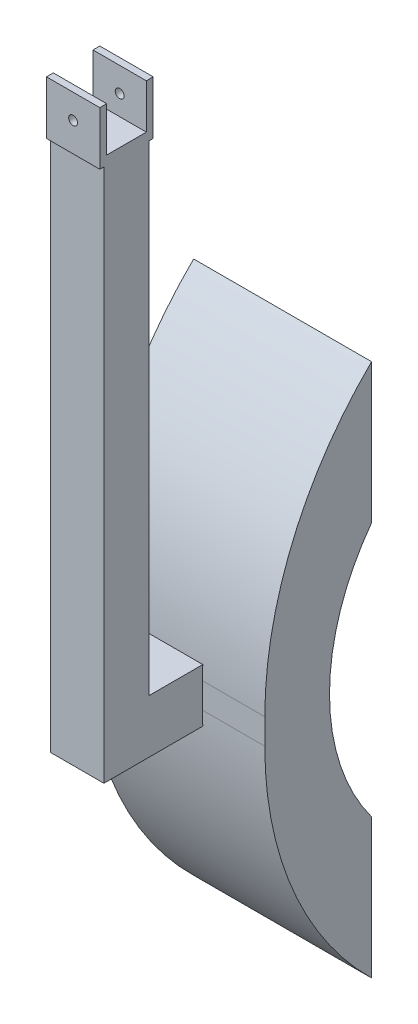
from build123d import *

# Parameters (mm, degrees)
SKETCH_1_W               = 30
SKETCH_1_H               = 22.307
EXTRUDE_1_DEPTH          = 2.5
EXTRUDE_START            = -5
SKETCH_4_W               = 30
SKETCH_4_H               = 3.8465
EXTRUDE_5_DEPTH          = 30
SKETCH_5_R               = 2.5
CUT_EXTRUDE_1_DEPTH      = 44.373378932
SKETCH_6_W               = 30
SKETCH_6_H               = 25.44
EXTRUDE_6_DEPTH          = 300
SKETCH_8_W               = 30
SKETCH_8_H               = 30
EXTRUDE_8_DEPTH          = 30
SKETCH_10_W              = 100
SKETCH_10_H              = 300
EXTRUDE_9_DEPTH          = 60
FILLET_1_R               = 200
FILLET_2_R               = 200
CUT_EXTRUDE_3_DEPTH      = 461.388584133
CUT_EXTRUDE_3_DEPTH_BACK = 461.388584133


with BuildPart() as part:
    # 草图1 → 凸台-拉伸1 (new, symmetric)
    with BuildSketch(Plane(origin=(0, 0, 0), x_dir=(1, 0, 0), z_dir=(0, 1, 0))):
        Rectangle(SKETCH_1_W, SKETCH_1_H)
    extrude(amount=EXTRUDE_1_DEPTH, both=True)

    # 草图4 → 凸台-拉伸5 (add)
    with BuildSketch(Plane(origin=(0, 2.5, 0), x_dir=(1, 0, 0), z_dir=(0, 1, 0)).offset(EXTRUDE_START)):
        with Locations((0, -13.07675)):
            Rectangle(SKETCH_4_W, SKETCH_4_H)
        with Locations((0, 13.07675)):
            Rectangle(SKETCH_4_W, SKETCH_4_H)
    extrude(amount=EXTRUDE_5_DEPTH)

    # 草图5 → 切除-拉伸1 (cut, through all)
    with BuildSketch(Plane.XY.offset(15)):
        with Locations((0, 13.784)):
            Circle(SKETCH_5_R)
    extrude(amount=-CUT_EXTRUDE_1_DEPTH, mode=Mode.SUBTRACT)

    # 草图6 → 凸台-拉伸6 (add)
    with BuildSketch(Plane.XZ.offset(2.5)):
        Rectangle(SKETCH_6_W, SKETCH_6_H)
    extrude(amount=EXTRUDE_6_DEPTH)

    # 草图8 → 凸台-拉伸8 (add)
    with BuildSketch(Plane(origin=(0, 0, -12.72), x_dir=(-1, 0, 0), z_dir=(0, 0, -1))):
        with Locations((0, -287.5)):
            Rectangle(SKETCH_8_W, SKETCH_8_H)
    extrude(amount=EXTRUDE_8_DEPTH)

    # 草图10 → 凸台-拉伸9 (add)
    with BuildSketch(Plane(origin=(0, 0, -42.72), x_dir=(-1, 0, 0), z_dir=(0, 0, -1))):
        with Locations((0, -287.5)):
            Rectangle(SKETCH_10_W, SKETCH_10_H)
    extrude(amount=EXTRUDE_9_DEPTH)

    # 圆角1
    # the kernel refuses this fillet: 200 mm, written as the material it takes off along each edge
    with BuildSketch(Plane(origin=(-407.071421427, -437.5, -42.72), x_dir=(0, 1, 0), z_dir=(1, 0, 0))) as fillet_1_piece_1_section:
        with BuildLine():
            CenterArc((142.828568571, -200), FILLET_1_R, 90, 45.572995999)
            Line((0, -60), (-2.856571371, -57.2))
            ThreePointArc((-2.856571371, -57.2), (-4, -30), (-4, 0))
            Line((-4, 0), (0, 4))
            Line((0, 4), (142.828568571, 4))
            Line((142.828568571, 4), (142.828568571, 0))
        make_face()
    fillet_1_piece_1 = extrude(amount=814.142842854, mode=Mode.PRIVATE)
    fillet_1_piece_1 = split(fillet_1_piece_1, bisect_by=Plane(origin=(-211.035710714, -302.5, -40.745799624), z_dir=(0, 1, 0)), keep=Keep.TOP, mode=Mode.PRIVATE)
    fillet_1_piece_1 = split(fillet_1_piece_1, bisect_by=Plane(origin=(-15, -298.610396999, -40.745799624), z_dir=(-1, 0, 0)), keep=Keep.TOP, mode=Mode.PRIVATE)
    add(fillet_1_piece_1, mode=Mode.SUBTRACT)
    with BuildSketch(Plane(origin=(-407.071421427, -437.5, -42.72), x_dir=(0, 1, 0), z_dir=(1, 0, 0))) as fillet_1_piece_2_section:
        with BuildLine():
            CenterArc((142.828568571, -200), FILLET_1_R, 90, 45.572995999)
            Line((0, -60), (-2.856571371, -57.2))
            ThreePointArc((-2.856571371, -57.2), (-4, -30), (-4, 0))
            Line((-4, 0), (0, 4))
            Line((0, 4), (142.828568571, 4))
            Line((142.828568571, 4), (142.828568571, 0))
        make_face()
    fillet_1_piece_2 = extrude(amount=814.142842854, mode=Mode.PRIVATE)
    fillet_1_piece_2 = split(fillet_1_piece_2, bisect_by=Plane(origin=(-211.035710714, -302.5, -57.711003377), z_dir=(0, -1, 0)), keep=Keep.TOP, mode=Mode.PRIVATE)
    fillet_1_piece_2 = split(fillet_1_piece_2, bisect_by=Plane(origin=(-15, -400.231636696, -57.711003377), z_dir=(-1, 0, 0)), keep=Keep.TOP, mode=Mode.PRIVATE)
    add(fillet_1_piece_2, mode=Mode.SUBTRACT)
    with BuildSketch(Plane(origin=(-407.071421427, -437.5, -42.72), x_dir=(0, 1, 0), z_dir=(1, 0, 0))) as fillet_1_piece_3_section:
        with BuildLine():
            CenterArc((142.828568571, -200), FILLET_1_R, 90, 45.572995999)
            Line((0, -60), (-2.856571371, -57.2))
            ThreePointArc((-2.856571371, -57.2), (-4, -30), (-4, 0))
            Line((-4, 0), (0, 4))
            Line((0, 4), (142.828568571, 4))
            Line((142.828568571, 4), (142.828568571, 0))
        make_face()
    fillet_1_piece_3 = extrude(amount=814.142842854, mode=Mode.PRIVATE)
    fillet_1_piece_3 = split(fillet_1_piece_3, bisect_by=Plane(origin=(0, -302.5, -57.711003377), z_dir=(0, -1, 0)), keep=Keep.TOP, mode=Mode.PRIVATE)
    fillet_1_piece_3 = split(fillet_1_piece_3, bisect_by=Plane(origin=(15, -400.231636696, -57.711003377), z_dir=(-1, 0, 0)), keep=Keep.TOP, mode=Mode.PRIVATE)
    fillet_1_piece_3 = split(fillet_1_piece_3, bisect_by=Plane(origin=(-15, -400.231636696, -57.711003377), z_dir=(1, 0, 0)), keep=Keep.TOP, mode=Mode.PRIVATE)
    add(fillet_1_piece_3, mode=Mode.SUBTRACT)
    with BuildSketch(Plane(origin=(-407.071421427, -437.5, -42.72), x_dir=(0, 1, 0), z_dir=(1, 0, 0))) as fillet_1_piece_4_section:
        with BuildLine():
            CenterArc((142.828568571, -200), FILLET_1_R, 90, 45.572995999)
            Line((0, -60), (-2.856571371, -57.2))
            ThreePointArc((-2.856571371, -57.2), (-4, -30), (-4, 0))
            Line((-4, 0), (0, 4))
            Line((0, 4), (142.828568571, 4))
            Line((142.828568571, 4), (142.828568571, 0))
        make_face()
    fillet_1_piece_4 = extrude(amount=814.142842854, mode=Mode.PRIVATE)
    fillet_1_piece_4 = split(fillet_1_piece_4, bisect_by=Plane(origin=(211.035710714, -302.5, -40.745799624), z_dir=(0, 1, 0)), keep=Keep.TOP, mode=Mode.PRIVATE)
    fillet_1_piece_4 = split(fillet_1_piece_4, bisect_by=Plane(origin=(15, -298.610396999, -40.745799624), z_dir=(1, 0, 0)), keep=Keep.TOP, mode=Mode.PRIVATE)
    add(fillet_1_piece_4, mode=Mode.SUBTRACT)
    with BuildSketch(Plane(origin=(-407.071421427, -437.5, -42.72), x_dir=(0, 1, 0), z_dir=(1, 0, 0))) as fillet_1_piece_5_section:
        with BuildLine():
            CenterArc((142.828568571, -200), FILLET_1_R, 90, 45.572995999)
            Line((0, -60), (-2.856571371, -57.2))
            ThreePointArc((-2.856571371, -57.2), (-4, -30), (-4, 0))
            Line((-4, 0), (0, 4))
            Line((0, 4), (142.828568571, 4))
            Line((142.828568571, 4), (142.828568571, 0))
        make_face()
    fillet_1_piece_5 = extrude(amount=814.142842854, mode=Mode.PRIVATE)
    fillet_1_piece_5 = split(fillet_1_piece_5, bisect_by=Plane(origin=(211.035710714, -302.5, -57.711003377), z_dir=(0, -1, 0)), keep=Keep.TOP, mode=Mode.PRIVATE)
    fillet_1_piece_5 = split(fillet_1_piece_5, bisect_by=Plane(origin=(15, -400.231636696, -57.711003377), z_dir=(1, 0, 0)), keep=Keep.TOP, mode=Mode.PRIVATE)
    add(fillet_1_piece_5, mode=Mode.SUBTRACT)

    # 圆角2
    # the kernel refuses this fillet: 200 mm, written as the material it takes off along each edge
    with BuildSketch(Plane(origin=(407.071421427, -137.5, -42.72), x_dir=(0, 0, -1), z_dir=(-1, 0, 0))) as fillet_2_piece_1_section:
        with BuildLine():
            CenterArc((200, 142.828568571), FILLET_2_R, 180, 45.572995999)
            Line((0, 142.828568571), (-4, 142.828568571))
            Line((-4, 142.828568571), (-4, 0))
            Line((-4, 0), (0, -4))
            ThreePointArc((0, -4), (30, -4), (57.2, -2.856571371))
            Line((57.2, -2.856571371), (60, 0))
        make_face()
    fillet_2_piece_1 = extrude(amount=814.142842854, mode=Mode.PRIVATE)
    fillet_2_piece_1 = split(fillet_2_piece_1, bisect_by=Plane(origin=(15, -174.768363304, -57.711003377), z_dir=(1, 0, 0)), keep=Keep.TOP, mode=Mode.PRIVATE)
    fillet_2_piece_1 = split(fillet_2_piece_1, bisect_by=Plane(origin=(211.035710714, -272.5, -57.711003377), z_dir=(0, 1, 0)), keep=Keep.TOP, mode=Mode.PRIVATE)
    add(fillet_2_piece_1, mode=Mode.SUBTRACT)
    with BuildSketch(Plane(origin=(407.071421427, -137.5, -42.72), x_dir=(0, 0, -1), z_dir=(-1, 0, 0))) as fillet_2_piece_2_section:
        with BuildLine():
            CenterArc((200, 142.828568571), FILLET_2_R, 180, 45.572995999)
            Line((0, 142.828568571), (-4, 142.828568571))
            Line((-4, 142.828568571), (-4, 0))
            Line((-4, 0), (0, -4))
            ThreePointArc((0, -4), (30, -4), (57.2, -2.856571371))
            Line((57.2, -2.856571371), (60, 0))
        make_face()
    fillet_2_piece_2 = extrude(amount=814.142842854, mode=Mode.PRIVATE)
    fillet_2_piece_2 = split(fillet_2_piece_2, bisect_by=Plane(origin=(15, -276.389603001, -40.745799624), z_dir=(1, 0, 0)), keep=Keep.TOP, mode=Mode.PRIVATE)
    fillet_2_piece_2 = split(fillet_2_piece_2, bisect_by=Plane(origin=(211.035710714, -272.5, -40.745799624), z_dir=(0, -1, 0)), keep=Keep.TOP, mode=Mode.PRIVATE)
    add(fillet_2_piece_2, mode=Mode.SUBTRACT)
    with BuildSketch(Plane(origin=(407.071421427, -137.5, -42.72), x_dir=(0, 0, -1), z_dir=(-1, 0, 0))) as fillet_2_piece_3_section:
        with BuildLine():
            CenterArc((200, 142.828568571), FILLET_2_R, 180, 45.572995999)
            Line((0, 142.828568571), (-4, 142.828568571))
            Line((-4, 142.828568571), (-4, 0))
            Line((-4, 0), (0, -4))
            ThreePointArc((0, -4), (30, -4), (57.2, -2.856571371))
            Line((57.2, -2.856571371), (60, 0))
        make_face()
    fillet_2_piece_3 = extrude(amount=814.142842854, mode=Mode.PRIVATE)
    fillet_2_piece_3 = split(fillet_2_piece_3, bisect_by=Plane(origin=(15, -174.768363304, -57.711003377), z_dir=(-1, 0, 0)), keep=Keep.TOP, mode=Mode.PRIVATE)
    fillet_2_piece_3 = split(fillet_2_piece_3, bisect_by=Plane(origin=(0, -272.5, -57.711003377), z_dir=(0, 1, 0)), keep=Keep.TOP, mode=Mode.PRIVATE)
    fillet_2_piece_3 = split(fillet_2_piece_3, bisect_by=Plane(origin=(-15, -174.768363304, -57.711003377), z_dir=(1, 0, 0)), keep=Keep.TOP, mode=Mode.PRIVATE)
    add(fillet_2_piece_3, mode=Mode.SUBTRACT)
    with BuildSketch(Plane(origin=(407.071421427, -137.5, -42.72), x_dir=(0, 0, -1), z_dir=(-1, 0, 0))) as fillet_2_piece_4_section:
        with BuildLine():
            CenterArc((200, 142.828568571), FILLET_2_R, 180, 45.572995999)
            Line((0, 142.828568571), (-4, 142.828568571))
            Line((-4, 142.828568571), (-4, 0))
            Line((-4, 0), (0, -4))
            ThreePointArc((0, -4), (30, -4), (57.2, -2.856571371))
            Line((57.2, -2.856571371), (60, 0))
        make_face()
    fillet_2_piece_4 = extrude(amount=814.142842854, mode=Mode.PRIVATE)
    fillet_2_piece_4 = split(fillet_2_piece_4, bisect_by=Plane(origin=(-211.035710714, -272.5, -57.711003377), z_dir=(0, 1, 0)), keep=Keep.TOP, mode=Mode.PRIVATE)
    fillet_2_piece_4 = split(fillet_2_piece_4, bisect_by=Plane(origin=(-15, -174.768363304, -57.711003377), z_dir=(-1, 0, 0)), keep=Keep.TOP, mode=Mode.PRIVATE)
    add(fillet_2_piece_4, mode=Mode.SUBTRACT)
    with BuildSketch(Plane(origin=(407.071421427, -137.5, -42.72), x_dir=(0, 0, -1), z_dir=(-1, 0, 0))) as fillet_2_piece_5_section:
        with BuildLine():
            CenterArc((200, 142.828568571), FILLET_2_R, 180, 45.572995999)
            Line((0, 142.828568571), (-4, 142.828568571))
            Line((-4, 142.828568571), (-4, 0))
            Line((-4, 0), (0, -4))
            ThreePointArc((0, -4), (30, -4), (57.2, -2.856571371))
            Line((57.2, -2.856571371), (60, 0))
        make_face()
    fillet_2_piece_5 = extrude(amount=814.142842854, mode=Mode.PRIVATE)
    fillet_2_piece_5 = split(fillet_2_piece_5, bisect_by=Plane(origin=(-211.035710714, -272.5, -40.745799624), z_dir=(0, -1, 0)), keep=Keep.TOP, mode=Mode.PRIVATE)
    fillet_2_piece_5 = split(fillet_2_piece_5, bisect_by=Plane(origin=(-15, -276.389603001, -40.745799624), z_dir=(-1, 0, 0)), keep=Keep.TOP, mode=Mode.PRIVATE)
    add(fillet_2_piece_5, mode=Mode.SUBTRACT)

    # 草图11 → 切除-拉伸3 (cut, two sides: drawn at the far end of the back side and taken through both)
    with BuildSketch(Plane(origin=(50, 0, 0), x_dir=(0, 0, -1), z_dir=(1, 0, 0)).offset(-CUT_EXTRUDE_3_DEPTH_BACK)):
        with BuildLine():
            Line((590.156631814, 440.987720299), (102.72, -215.998843293))
            ThreePointArc((102.72, -215.998843293), (79.092115208, -287.5), (102.72, -359.001156707))
            Line((102.72, -359.001156707), (590.156631814, -1015.987720299))
            Line((590.156631814, -1015.987720299), (2226.281095019, -1015.987720299))
            Line((2226.281095019, -1015.987720299), (2226.281095019, 440.987720299))
            Line((2226.281095019, 440.987720299), (590.156631814, 440.987720299))
        make_face()
    extrude(amount=CUT_EXTRUDE_3_DEPTH + CUT_EXTRUDE_3_DEPTH_BACK, mode=Mode.SUBTRACT)


solid = part.part
